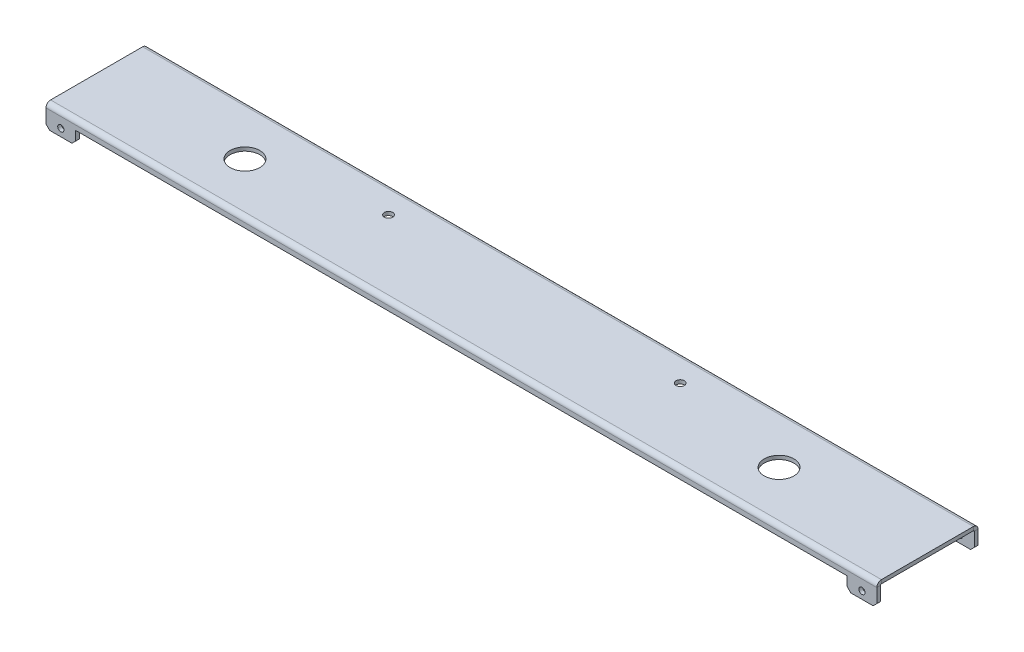
from build123d import *

# Parameters (mm, degrees)
SKETCH1_W              = 711.2
SKETCH1_H              = 78.74
BOSS_EXTRUDE1_DEPTH    = 3.175
EDGE_FLANGE1_DEPTH     = 711.2
EDGE_FLANGE2_DEPTH     = 711.2
SKETCH14_R             = 2.667
UPPER_FLANGE_HP_DEPTH  = 717.630616581
CUT_EXTRUDE7_START     = -3.175
CUT_EXTRUDE7_OUTLINE_W = 660.4
CUT_EXTRUDE7_OUTLINE_H = 20.875
CUT_EXTRUDE7_OUTLINE_R = 2.667
CUT_EXTRUDE7_DEPTH     = 3.937
CHAMFER1_SIZE          = 3.175
SKETCH22_W             = 3.175
SKETCH22_H             = 11.938
BOSS_EXTRUDE2_DEPTH    = 660.4
SKETCH23_W             = 660.4
SKETCH23_H             = 7.9375
CUT_EXTRUDE8_DEPTH     = 127
SKETCH24_R             = 12.7
CUT_EXTRUDE9_DEPTH     = 717.165443144
SKETCH25_R             = 3.571875
CUT_EXTRUDE10_DEPTH    = 254


# Read off the part's stored shape, not the designer's step: Cut-Extrude7
# Sheet-metal steps are written as plain solids
with BuildPart() as part:
    # Sketch1 → Boss-Extrude1 (new body)
    with BuildSketch(Plane(origin=(0, 0, 0), x_dir=(1, 0, 0), z_dir=(0, 1, 0))):
        with Locations((355.6, 39.37)):
            Rectangle(SKETCH1_W, SKETCH1_H)
    extrude(amount=BOSS_EXTRUDE1_DEPTH)

    # Edge-Flange1 section (across the edge) → Edge-Flange1 (add)
    with BuildSketch(Plane(origin=(711.2, 0, 0.762), x_dir=(0, 0, -1), z_dir=(-1, 0, 0))):
        with BuildLine():
            Line((-3.175, 0.762), (-3.175, 15.875))
            Line((-3.175, 15.875), (0, 15.875))
            Line((0, 15.875), (0, 0.762))
            ThreePointArc((0, 0.762), (0.223184633, 0.223184633), (0.762, 0))
            Line((0.762, 0), (0.762, -3.175))
            ThreePointArc((0.762, -3.175), (-2.021879398, -2.021879398), (-3.175, 0.762))
        make_face()
    extrude(amount=EDGE_FLANGE1_DEPTH)

    # Edge-Flange2 section (across the edge) → Edge-Flange2 (add)
    with BuildSketch(Plane(origin=(0, 0, -79.502), x_dir=(0, 0, 1), z_dir=(1, 0, 0))):
        with BuildLine():
            Line((-3.175, 0.762), (-3.175, 15.875))
            Line((-3.175, 15.875), (0, 15.875))
            Line((0, 15.875), (0, 0.762))
            ThreePointArc((0, 0.762), (0.223184633, 0.223184633), (0.762, 0))
            Line((0.762, 0), (0.762, -3.175))
            ThreePointArc((0.762, -3.175), (-2.021879398, -2.021879398), (-3.175, 0.762))
        make_face()
    extrude(amount=EDGE_FLANGE2_DEPTH)

    # Sketch14 → upper flange HP (cut, through all)
    with BuildSketch(Plane(origin=(0, 0, -82.677), x_dir=(-1, 0, 0), z_dir=(0, 0, -1))):
        with Locations(Location((-12.7, -9.525, 0), (0, 0, 90))):
            Circle(SKETCH14_R)
        with Locations(Location((-38.1, -9.525, 0), (0, 0, 90))):
            Circle(SKETCH14_R)
        with Locations(Location((-63.5, -9.525, 0), (0, 0, 90))):
            Circle(SKETCH14_R)
        with Locations(Location((-88.9, -9.525, 0), (0, 0, 90))):
            Circle(SKETCH14_R)
        with Locations(Location((-114.3, -9.525, 0), (0, 0, 90))):
            Circle(SKETCH14_R)
        with Locations(Location((-139.7, -9.525, 0), (0, 0, 90))):
            Circle(SKETCH14_R)
        with Locations(Location((-165.1, -9.525, 0), (0, 0, 90))):
            Circle(SKETCH14_R)
        with Locations(Location((-190.5, -9.525, 0), (0, 0, 90))):
            Circle(SKETCH14_R)
        with Locations(Location((-215.9, -9.525, 0), (0, 0, 90))):
            Circle(SKETCH14_R)
        with Locations(Location((-241.3, -9.525, 0), (0, 0, 90))):
            Circle(SKETCH14_R)
        with Locations(Location((-266.7, -9.525, 0), (0, 0, 90))):
            Circle(SKETCH14_R)
        with Locations(Location((-292.1, -9.525, 0), (0, 0, 90))):
            Circle(SKETCH14_R)
        with Locations(Location((-317.5, -9.525, 0), (0, 0, 90))):
            Circle(SKETCH14_R)
        with Locations(Location((-342.9, -9.525, 0), (0, 0, 90))):
            Circle(SKETCH14_R)
        with Locations(Location((-368.3, -9.525, 0), (0, 0, 90))):
            Circle(SKETCH14_R)
        with Locations(Location((-393.7, -9.525, 0), (0, 0, 90))):
            Circle(SKETCH14_R)
        with Locations(Location((-419.1, -9.525, 0), (0, 0, 90))):
            Circle(SKETCH14_R)
        with Locations(Location((-444.5, -9.525, 0), (0, 0, 90))):
            Circle(SKETCH14_R)
        with Locations(Location((-469.9, -9.525, 0), (0, 0, 90))):
            Circle(SKETCH14_R)
        with Locations(Location((-495.3, -9.525, 0), (0, 0, 90))):
            Circle(SKETCH14_R)
        with Locations(Location((-520.7, -9.525, 0), (0, 0, 90))):
            Circle(SKETCH14_R)
        with Locations(Location((-546.1, -9.525, 0), (0, 0, 90))):
            Circle(SKETCH14_R)
        with Locations(Location((-571.5, -9.525, 0), (0, 0, 90))):
            Circle(SKETCH14_R)
        with Locations(Location((-596.9, -9.525, 0), (0, 0, 90))):
            Circle(SKETCH14_R)
        with Locations(Location((-622.3, -9.525, 0), (0, 0, 90))):
            Circle(SKETCH14_R)
        with Locations(Location((-647.7, -9.525, 0), (0, 0, 90))):
            Circle(SKETCH14_R)
        with Locations(Location((-673.1, -9.525, 0), (0, 0, 90))):
            Circle(SKETCH14_R)
        with Locations(Location((-698.5, -9.525, 0), (0, 0, 90))):
            Circle(SKETCH14_R)
        with Locations((-723.9, -9.525)):
            Circle(SKETCH14_R)
        with Locations((-749.3, -9.525)):
            Circle(SKETCH14_R)
        with Locations((-774.7, -9.525)):
            Circle(SKETCH14_R)
        with Locations((-800.1, -9.525)):
            Circle(SKETCH14_R)
    extrude(amount=-UPPER_FLANGE_HP_DEPTH, mode=Mode.SUBTRACT)

    # Cut-Extrude7 outline → Cut-Extrude7 (cut)
    with BuildSketch(Plane(origin=(0, 0, 0.762), x_dir=(-1, 0, 0), z_dir=(0, 0, -1)).offset(CUT_EXTRUDE7_START)):
        with Locations((-355.6, -5.4375)):
            Rectangle(CUT_EXTRUDE7_OUTLINE_W, CUT_EXTRUDE7_OUTLINE_H)
        with Locations((-673.1, -9.525)):
            Circle(CUT_EXTRUDE7_OUTLINE_R, mode=Mode.SUBTRACT)
        with Locations((-647.7, -9.525)):
            Circle(CUT_EXTRUDE7_OUTLINE_R, mode=Mode.SUBTRACT)
        with Locations((-622.3, -9.525)):
            Circle(CUT_EXTRUDE7_OUTLINE_R, mode=Mode.SUBTRACT)
        with Locations((-596.9, -9.525)):
            Circle(CUT_EXTRUDE7_OUTLINE_R, mode=Mode.SUBTRACT)
        with Locations((-571.5, -9.525)):
            Circle(CUT_EXTRUDE7_OUTLINE_R, mode=Mode.SUBTRACT)
        with Locations((-546.1, -9.525)):
            Circle(CUT_EXTRUDE7_OUTLINE_R, mode=Mode.SUBTRACT)
        with Locations((-520.7, -9.525)):
            Circle(CUT_EXTRUDE7_OUTLINE_R, mode=Mode.SUBTRACT)
        with Locations((-495.3, -9.525)):
            Circle(CUT_EXTRUDE7_OUTLINE_R, mode=Mode.SUBTRACT)
        with Locations((-469.9, -9.525)):
            Circle(CUT_EXTRUDE7_OUTLINE_R, mode=Mode.SUBTRACT)
        with Locations((-444.5, -9.525)):
            Circle(CUT_EXTRUDE7_OUTLINE_R, mode=Mode.SUBTRACT)
        with Locations((-419.1, -9.525)):
            Circle(CUT_EXTRUDE7_OUTLINE_R, mode=Mode.SUBTRACT)
        with Locations((-393.7, -9.525)):
            Circle(CUT_EXTRUDE7_OUTLINE_R, mode=Mode.SUBTRACT)
        with Locations((-368.3, -9.525)):
            Circle(CUT_EXTRUDE7_OUTLINE_R, mode=Mode.SUBTRACT)
        with Locations((-342.9, -9.525)):
            Circle(CUT_EXTRUDE7_OUTLINE_R, mode=Mode.SUBTRACT)
        with Locations((-317.5, -9.525)):
            Circle(CUT_EXTRUDE7_OUTLINE_R, mode=Mode.SUBTRACT)
        with Locations((-292.1, -9.525)):
            Circle(CUT_EXTRUDE7_OUTLINE_R, mode=Mode.SUBTRACT)
        with Locations((-266.7, -9.525)):
            Circle(CUT_EXTRUDE7_OUTLINE_R, mode=Mode.SUBTRACT)
        with Locations((-241.3, -9.525)):
            Circle(CUT_EXTRUDE7_OUTLINE_R, mode=Mode.SUBTRACT)
        with Locations((-215.9, -9.525)):
            Circle(CUT_EXTRUDE7_OUTLINE_R, mode=Mode.SUBTRACT)
        with Locations((-190.5, -9.525)):
            Circle(CUT_EXTRUDE7_OUTLINE_R, mode=Mode.SUBTRACT)
        with Locations((-165.1, -9.525)):
            Circle(CUT_EXTRUDE7_OUTLINE_R, mode=Mode.SUBTRACT)
        with Locations((-139.7, -9.525)):
            Circle(CUT_EXTRUDE7_OUTLINE_R, mode=Mode.SUBTRACT)
        with Locations((-114.3, -9.525)):
            Circle(CUT_EXTRUDE7_OUTLINE_R, mode=Mode.SUBTRACT)
        with Locations((-88.9, -9.525)):
            Circle(CUT_EXTRUDE7_OUTLINE_R, mode=Mode.SUBTRACT)
        with Locations((-63.5, -9.525)):
            Circle(CUT_EXTRUDE7_OUTLINE_R, mode=Mode.SUBTRACT)
        with Locations((-38.1, -9.525)):
            Circle(CUT_EXTRUDE7_OUTLINE_R, mode=Mode.SUBTRACT)
    extrude(amount=CUT_EXTRUDE7_DEPTH, mode=Mode.SUBTRACT)

    # Chamfer1
    chamfer1_edges = [part.edges().sort_by_distance(p)[0] for p in [
        (711.2, -15.875, 2.3495),
        (0, -15.875, 2.3495),
        (25.4, -15.875, 2.3495),
        (685.8, -15.875, 2.3495),
        (0, -15.875, -81.0895),
        (711.2, -15.875, -81.0895),
    ]]
    chamfer(chamfer1_edges, length=CHAMFER1_SIZE)

    # Sketch22 → Boss-Extrude2 (add)
    with BuildSketch(Plane.ZY.offset(-685.8)):
        with BuildLine():
            ThreePointArc((0, 0), (0.538815367, -0.223184633), (0.762, -0.762))
            Line((0.762, -0.762), (3.937, -0.762))
            ThreePointArc((3.937, -0.762), (2.783879398, 2.021879398), (0, 3.175))
            Line((0, 3.175), (0, 0))
        make_face()
        with Locations((2.3495, -6.731)):
            Rectangle(SKETCH22_W, SKETCH22_H)
    extrude(amount=BOSS_EXTRUDE2_DEPTH)

    # Sketch23 → Cut-Extrude8 (cut)
    with BuildSketch(Plane(origin=(0, 0, 0.762), x_dir=(-1, 0, 0), z_dir=(0, 0, -1))):
        with Locations((-355.6, -8.73125)):
            Rectangle(SKETCH23_W, SKETCH23_H)
    extrude(amount=-CUT_EXTRUDE8_DEPTH, mode=Mode.SUBTRACT)

    # Sketch24 → Cut-Extrude9 (cut, through all)
    with BuildSketch(Plane(origin=(0, 0, 0), x_dir=(-1, 0, 0), z_dir=(0, -1, 0))):
        with Locations(Location((-584.2, 39.37, 0), (0, 0, 90))):
            Circle(SKETCH24_R)
        with Locations(Location((-127, 39.37, 0), (0, 0, 90))):
            Circle(SKETCH24_R)
    extrude(amount=-CUT_EXTRUDE9_DEPTH, mode=Mode.SUBTRACT)

    # Sketch25 → Cut-Extrude10 (cut)
    with BuildSketch(Plane.XZ):
        with Locations(Location((479.4, -59.502, 0), (0, 0, 270))):
            Circle(SKETCH25_R)
        with Locations(Location((229.79920635, -59.502, 0), (0, 0, 270))):
            Circle(SKETCH25_R)
    extrude(amount=-CUT_EXTRUDE10_DEPTH, mode=Mode.SUBTRACT)


solid = part.part
